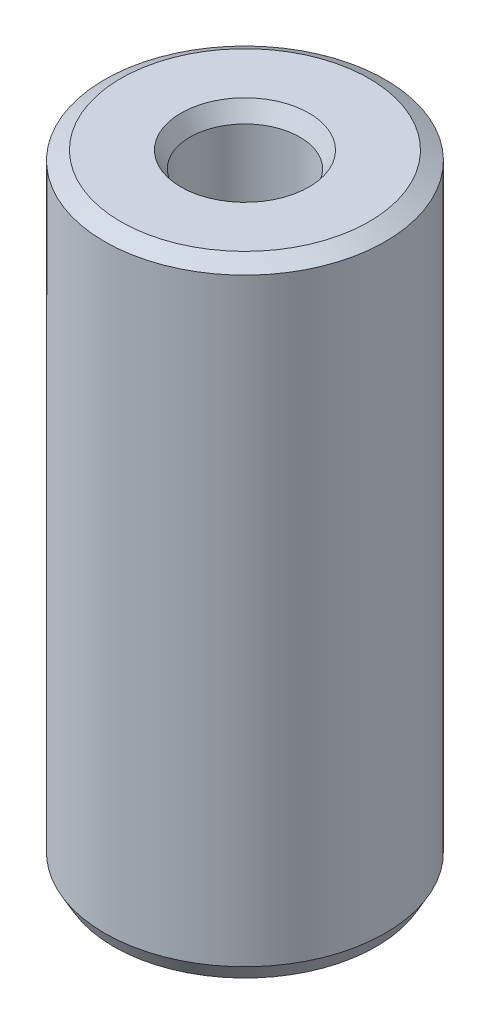
from build123d import *
from OCP.BRepFilletAPI import BRepFilletAPI_MakeChamfer

# Parameters (mm, degrees)
SKETCH1_R           = 22.5
BOSS_EXTRUDE1_DEPTH = 100.083481992
SKETCH2_R           = 8.807531717
CUT_EXTRUDE1_DEPTH  = 106.020014129
CHAMFER1_SIZE       = 1.462129308
CHAMFER1_SIZE2      = 2.600149279


with BuildPart() as part:
    # Sketch1 → Boss-Extrude1 (new body)
    with BuildSketch(Plane(origin=(0, 0, 0), x_dir=(1, 0, 0), z_dir=(0, 1, 0))):
        Circle(SKETCH1_R)
    extrude(amount=BOSS_EXTRUDE1_DEPTH)

    # Sketch2 → Cut-Extrude1 (cut, through all)
    with BuildSketch(Plane(origin=(0, 0, 0), x_dir=(1, 0, 0), z_dir=(0, 1, 0))):
        Circle(SKETCH2_R)
    extrude(amount=CUT_EXTRUDE1_DEPTH, mode=Mode.SUBTRACT)

    # Chamfer1: one chamfer whose edges measure the first distance from different faces: ONE call of the kernel's chamfer builder (chamfer() names one face for all edges)
    chamfer1_edges_1 = [part.edges().sort_by_distance(p)[0] for p in [
        (-8.807531717, 100.083481992, 0),
    ]]
    chamfer1_side_1 = [part.faces().sort_by_distance(p)[0] for p in [
        (-21.863603897, 100.083481992, 0),
    ]]
    chamfer1_edges_2 = [part.edges().sort_by_distance(p)[0] for p in [
        (-8.807531717, 0, 0),
    ]]
    chamfer1_side_2 = [part.faces().sort_by_distance(p)[0] for p in [
        (-8.807531717, 50.041740996, 0),
    ]]
    chamfer1_edges_3 = [part.edges().sort_by_distance(p)[0] for p in [
        (-22.5, 0, 0),
    ]]
    chamfer1_side_3 = [part.faces().sort_by_distance(p)[0] for p in [
        (-21.863603897, 0, 0),
    ]]
    chamfer1_edges_4 = [part.edges().sort_by_distance(p)[0] for p in [
        (-22.5, 100.083481992, 0),
    ]]
    chamfer1_side_4 = [part.faces().sort_by_distance(p)[0] for p in [
        (-22.5, 50.041740996, 0),
    ]]
    chamfer1 = BRepFilletAPI_MakeChamfer(part.part.solid().wrapped)
    for e in chamfer1_edges_1:
        chamfer1.Add(CHAMFER1_SIZE, CHAMFER1_SIZE2, e.wrapped, chamfer1_side_1[0].wrapped)  # the first distance lies on this face
    for e in chamfer1_edges_2:
        chamfer1.Add(CHAMFER1_SIZE, CHAMFER1_SIZE2, e.wrapped, chamfer1_side_2[0].wrapped)  # the first distance lies on this face
    for e in chamfer1_edges_3:
        chamfer1.Add(CHAMFER1_SIZE, CHAMFER1_SIZE2, e.wrapped, chamfer1_side_3[0].wrapped)  # the first distance lies on this face
    for e in chamfer1_edges_4:
        chamfer1.Add(CHAMFER1_SIZE, CHAMFER1_SIZE2, e.wrapped, chamfer1_side_4[0].wrapped)  # the first distance lies on this face
    add(Compound.cast(chamfer1.Shape()), mode=Mode.REPLACE)


solid = part.part
